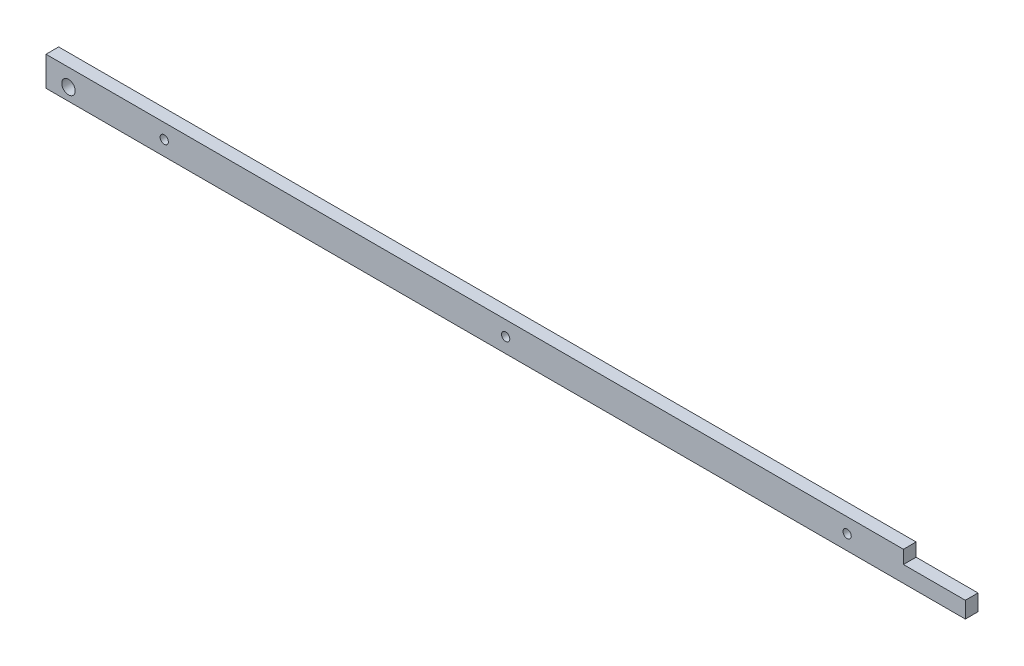
from build123d import *

# Parameters (mm, degrees)
SKETCH1_R           = 2.4892
SKETCH1_R_2         = 4.0635
BOSS_EXTRUDE1_DEPTH = 7.62


with BuildPart() as part:
    # Sketch1 → Boss-Extrude1 (new body)
    with BuildSketch(Plane.XY):
        Polygon((0, 12.964410589), (515.860000058, 12.964410589), (515.860000058, 5.019410589), (553.1, 5.019410589), (553.1, -4.800589411), (0, -4.800589411), align=None)
        with Locations((481.98, 4.081910589)):
            Circle(SKETCH1_R, mode=Mode.SUBTRACT)
        with Locations((276.55, 4.081910589)):
            Circle(SKETCH1_R, mode=Mode.SUBTRACT)
        with Locations((71.12, 4.081910589)):
            Circle(SKETCH1_R, mode=Mode.SUBTRACT)
        with Locations((13.54, 2.599410589)):
            Circle(SKETCH1_R_2, mode=Mode.SUBTRACT)
    extrude(amount=BOSS_EXTRUDE1_DEPTH)


solid = part.part
